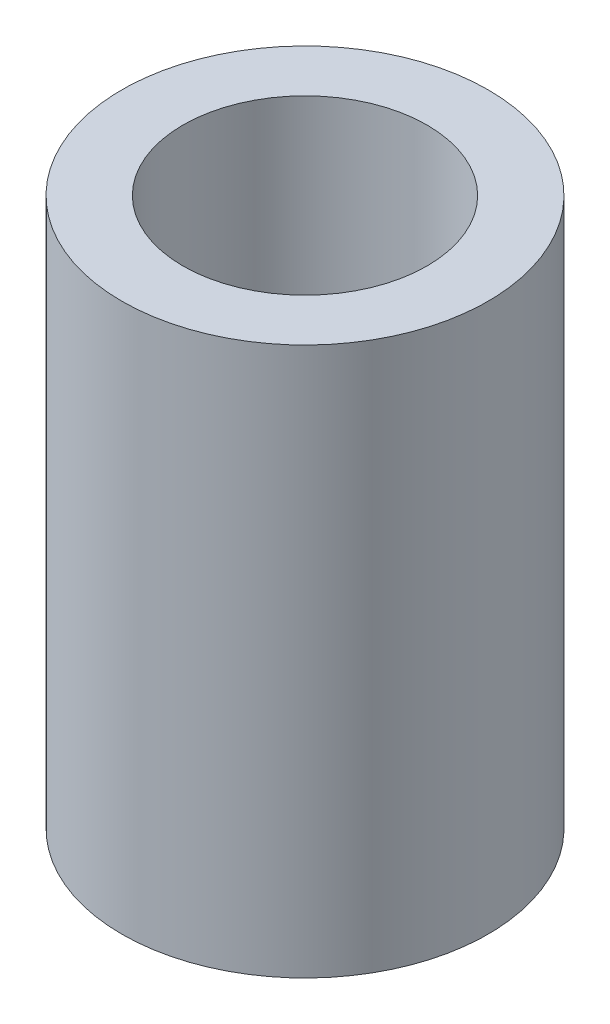
from build123d import *

# Parameters (mm, degrees)
SKETCH1_R           = 3.81
SKETCH1_R_2         = 2.54
BOSS_EXTRUDE1_DEPTH = 11.4046


with BuildPart() as part:
    # Sketch1 → Boss-Extrude1 (new body)
    with BuildSketch(Plane(origin=(0, 0, 0), x_dir=(1, 0, 0), z_dir=(0, 1, 0))):
        Circle(SKETCH1_R)
        Circle(SKETCH1_R_2, mode=Mode.SUBTRACT)
    extrude(amount=BOSS_EXTRUDE1_DEPTH)


solid = part.part
